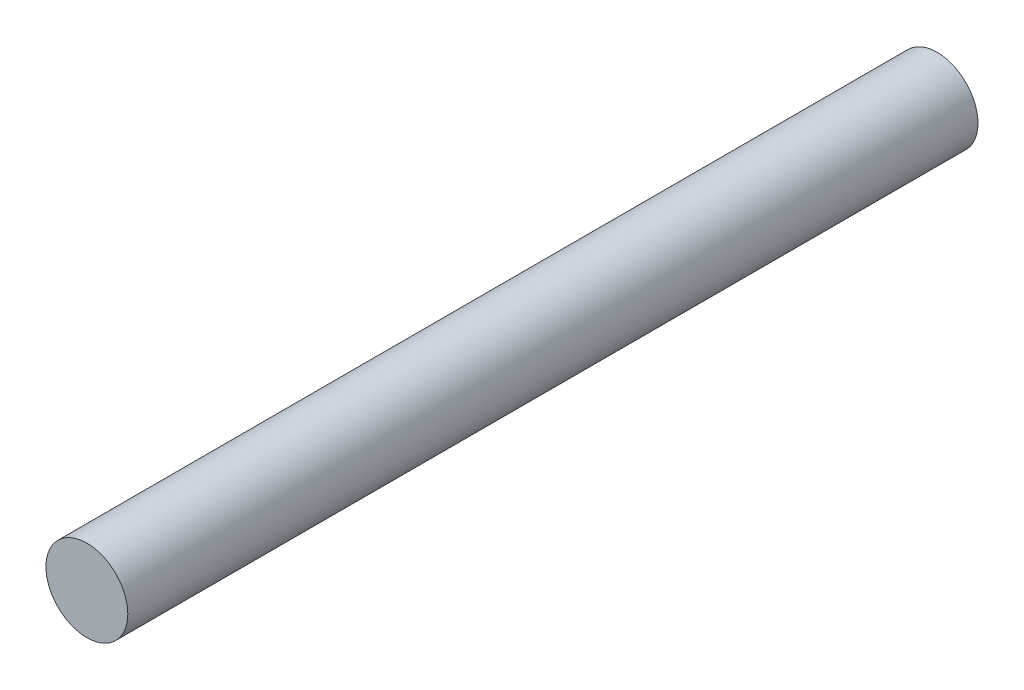
from build123d import *

# Parameters (mm, degrees)
SKETCH_1_R      = 6.260668565
EXTRUDE_1_DEPTH = 130


with BuildPart() as part:
    # 草图1 → 凸台-拉伸1 (new body)
    with BuildSketch(Plane.XY):
        Circle(SKETCH_1_R)
    extrude(amount=EXTRUDE_1_DEPTH)


solid = part.part
